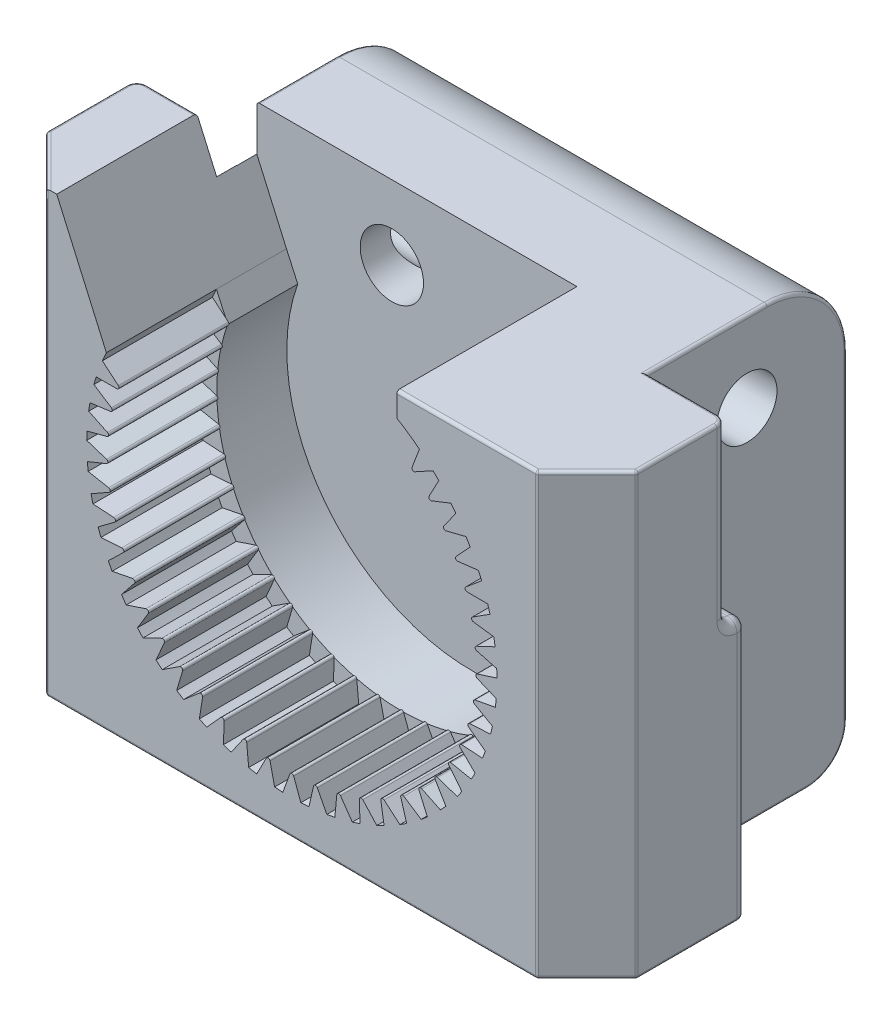
from build123d import *

# Parameters (mm, degrees)
SKETCH_1_W               = 59
SKETCH_1_H               = 44
EXTRUDE_1_DEPTH          = 34
SKETCH_2_R               = 4
CUT_EXTRUDE_1_DEPTH      = 51.102395152
CUT_EXTRUDE_2_DEPTH      = 63.946405775
CUT_EXTRUDE_3_DEPTH      = 18
CHAMFER_1_SIZE           = 5
CHAMFER_2_SIZE           = 5
FILLET_1_R               = 4
FILLET_2_R               = 8
SKETCH_6_R               = 3
CUT_EXTRUDE_4_DEPTH      = 66.122960621
CUT_EXTRUDE_5_DEPTH      = 2
FILLET_START             = -30
FILLET_3_DEPTH           = 8.5
FILLET_START_2           = 21.5
FILLET_3_2_DEPTH         = 8.5
FILLET_START_3           = -29.5
FILLET_3_3_DEPTH         = 8
FILLET_3_4_DEPTH         = 8
FILLET_4_R               = 1
FILLET_5_R               = 0.3
FILLET_6_R               = 0.3
EXTRUDE_START            = 7
EXTRUDE_2_DEPTH          = 7
EXTRUDE_3_DEPTH          = 11
PATTERN_CIRCULAR_1_COUNT = 16
PATTERN_CIRCULAR_1_ANGLE = 110
PATTERN_CIRCULAR_2_COUNT = 20
PATTERN_CIRCULAR_2_ANGLE = 139
SKETCH_11_R              = 3.162938161
CUT_EXTRUDE_6_DEPTH      = 41.966449688


with BuildPart() as part:
    # Эскиз1 → Бобышка-Вытянуть1 (new body)
    with BuildSketch(Plane.XY):
        Rectangle(SKETCH_1_W, SKETCH_1_H)
    extrude(amount=EXTRUDE_1_DEPTH)

    # Эскиз2 → Вырез-Вытянуть1 (cut, through all)
    with BuildSketch(Plane.XY.offset(34)):
        with Locations((0, 2)):
            Circle(SKETCH_2_R)
    extrude(amount=-CUT_EXTRUDE_1_DEPTH, mode=Mode.SUBTRACT)

    # Эскиз3 → Вырез-Вытянуть2 (cut, through all)
    with BuildSketch(Plane(origin=(0, 22, 0), x_dir=(1, 0, 0), z_dir=(0, 1, 0))):
        Polygon((-21.5, 5.182820552), (-21.5, -18), (-29.840908982, -18), (-29.840908982, 8.49465206), (29.840908982, 8.49465206), (29.840908982, -18), (21.5, -18), (21.5, 5.182820552), align=None)
    extrude(amount=-CUT_EXTRUDE_2_DEPTH, mode=Mode.SUBTRACT)

    # Эскиз4 → Вырез-Вытянуть3 (cut)
    with BuildSketch(Plane.XY.offset(34)):
        with BuildLine():
            Line((-23.5, 22), (-18.535280006, 10.757476525))
            ThreePointArc((-18.535280006, 10.757476525), (5.976548945, -17.609458501), (10.5, 19.606816862))
            Line((10.5, 19.606816862), (10.5, 22))
            Line((10.5, 22), (-23.5, 22))
        make_face()
    extrude(amount=-CUT_EXTRUDE_3_DEPTH, mode=Mode.SUBTRACT)

    # Фаска1
    chamfer_1_edges = [part.edges().sort_by_distance(p)[0] for p in [
        (-29.5, 0, 34),
    ]]
    chamfer(chamfer_1_edges, length=CHAMFER_1_SIZE)

    # Фаска2
    chamfer_2_edges = [part.edges().sort_by_distance(p)[0] for p in [
        (29.5, 0, 34),
    ]]
    chamfer(chamfer_2_edges, length=CHAMFER_2_SIZE)

    # Скругление1
    fillet_1_edges = [part.edges().sort_by_distance(p)[0] for p in [
        (0, -22, 0),
    ]]
    fillet(fillet_1_edges, radius=FILLET_1_R)

    # Скругление2
    fillet_2_edges = [part.edges().sort_by_distance(p)[0] for p in [
        (0, 22, 0),
    ]]
    fillet(fillet_2_edges, radius=FILLET_2_R)

    # Эскиз6 → Вырез-Вытянуть4 (cut, through all)
    with BuildSketch(Plane.ZY.offset(21.5)):
        with Locations((10, 14)):
            Circle(SKETCH_6_R)
    extrude(amount=-CUT_EXTRUDE_4_DEPTH, mode=Mode.SUBTRACT)

    # Эскиз7 → Вырез-Вытянуть5 (cut)
    with BuildSketch(Plane(origin=(0, 0, 18), x_dir=(-1, 0, 0), z_dir=(0, 0, -1))):
        Polygon((-29.5, 4), (-21.5, 4), (-21.5, 24.855557452), (21.514282903, 24.855557452), (21.5, 4), (29.5, 4), (29.5, 28.131804125), (-29.5, 28.131804125), align=None)
    extrude(amount=-CUT_EXTRUDE_5_DEPTH, mode=Mode.SUBTRACT)

    # Скругление3: read off the stored shape, not the designer's step
    # Скругление3 outline → Скругление3 (cut)
    with BuildSketch(Plane.YZ.offset(FILLET_START)):
        with BuildLine():
            Line((4, 18), (4, 19))
            ThreePointArc((4, 19), (3.707106781, 18.292893219), (3, 18))
            Line((3, 18), (4, 18))
        make_face()
    extrude(amount=FILLET_3_DEPTH, mode=Mode.SUBTRACT)

    # Fillet 3 2 outline → Fillet 3 2 (cut)
    with BuildSketch(Plane.YZ.offset(FILLET_START_2)):
        with BuildLine():
            Line((4, 18), (4, 19))
            ThreePointArc((4, 19), (3.707106781, 18.292893219), (3, 18))
            Line((3, 18), (4, 18))
        make_face()
    extrude(amount=FILLET_3_2_DEPTH, mode=Mode.SUBTRACT)

    # Fillet 3 3 outline → Fillet 3 3 (add)
    with BuildSketch(Plane.YZ.offset(FILLET_START_3)):
        with BuildLine():
            Line((4, 20), (4, 19))
            ThreePointArc((4, 19), (4.292893219, 19.707106781), (5, 20))
            Line((5, 20), (4, 20))
        make_face()
    extrude(amount=FILLET_3_3_DEPTH)

    # Fillet 3 4 outline → Fillet 3 4 (add)
    with BuildSketch(Plane.YZ.offset(FILLET_START_2)):
        with BuildLine():
            Line((4, 20), (4, 19))
            ThreePointArc((4, 19), (4.292893219, 19.707106781), (5, 20))
            Line((5, 20), (4, 20))
        make_face()
    extrude(amount=FILLET_3_4_DEPTH)

    # Скругление4
    fillet_4_edges = [part.edges().sort_by_distance(p)[0] for p in [
        (29.5, 13.5, 20),
        (-29.5, 13.5, 20),
        (-29.5, -9.5, 18),
        (-29.5, 3.707106781, 18.292893219),
        (29.5, 3.707106781, 18.292893219),
        (-29.5, 4.292893219, 19.707106781),
        (29.5, 4.292893219, 19.707106781),
        (29.5, -9.5, 18),
    ]]
    fillet(fillet_4_edges, radius=FILLET_4_R)

    # Скругление5
    fillet_5_edges = [part.edges().sort_by_distance(p)[0] for p in [
        (21.5, -22, 11),
        (21.5, -2, 0),
        (21.5, -20.828427125, 1.171572875),
        (-21.5, -20.828427125, 1.171572875),
        (21.5, 22, 14),
        (-21.5, -2, 0),
        (-21.5, 19.656854249, 2.343145751),
        (21.5, 19.656854249, 2.343145751),
        (-21.5, -22, 11),
        (-21.5, 22, 12),
    ]]
    fillet(fillet_5_edges, radius=FILLET_5_R)

    # Скругление6
    fillet_6_edges = [part.edges().sort_by_distance(p)[0] for p in [
        (-26, 22, 20),
        (-29.207106781, 22, 20.292893219),
        (24.85, 22, 20),
        (29.207106781, 22, 20.292893219),
        (-24.85, -22, 18),
        (-29.207106781, -22, 18.292893219),
        (24.85, -22, 18),
        (29.207106781, -22, 18.292893219),
        (-29.5, 0, 29),
        (-29.5, 22, 25),
        (-27, 22, 31.5),
        (-24.5, 0, 34),
        (29.5, 22, 25),
        (27, 22, 31.5),
        (17.5, 22, 34),
        (29.5, 0, 29),
        (24.5, 0, 34),
        (-29.5, -22, 24),
        (-27, -22, 31.5),
        (29.5, -22, 24),
        (27, -22, 31.5),
        (0, -22, 34),
    ]]
    fillet(fillet_6_edges, radius=FILLET_6_R)

    # Эскиз8 → Бобышка-Вытянуть2 (add)
    with BuildSketch(Plane.XY.offset(16).offset(EXTRUDE_START)):
        with BuildLine():
            Line((-18.535280006, 10.757476525), (-17.407140213, 8.264301206))
            ThreePointArc((-17.407140213, 8.264301206), (5.659506801, -15.613062845), (10.5, 17.231546212))
            Line((10.5, 17.231546212), (10.5, 19.606816862))
            ThreePointArc((10.5, 19.606816862), (5.976548945, -17.609458501), (-18.535280006, 10.757476525))
        make_face()
    extrude(amount=-EXTRUDE_2_DEPTH)

    # Эскиз10 → Бобышка-Вытянуть3 (add)
    with BuildSketch(Plane.XY.offset(23)):
        with BuildLine():
            Line((-0.187775263, -16.530367751), (-1.1, -19.018253397))
            Line((-1.1, -19.018253397), (1.1, -19.018253397))
            Line((1.1, -19.018253397), (0.187775263, -16.530367751))
            ThreePointArc((0.187775263, -16.530367751), (0, -16.399218681), (-0.187775263, -16.530367751))
        make_face()
    extrude_3 = extrude(amount=EXTRUDE_3_DEPTH)

    # Круговой массив1: Бобышка-Вытянуть3 ×16 about axis
    pattern_circular_1_axis = Axis((0, 2, 0), (0, 0, -1))
    for i in range(1, PATTERN_CIRCULAR_1_COUNT):
        add(extrude_3.rotate(pattern_circular_1_axis, i * PATTERN_CIRCULAR_1_ANGLE / (PATTERN_CIRCULAR_1_COUNT - 1)))

    # Круговой массив2: Бобышка-Вытянуть3 ×20 about axis
    pattern_circular_2_axis = Axis((0, 2, 0), (0, 0, 1))
    for i in range(1, PATTERN_CIRCULAR_2_COUNT):
        add(extrude_3.rotate(pattern_circular_2_axis, i * PATTERN_CIRCULAR_2_ANGLE / (PATTERN_CIRCULAR_2_COUNT - 1)))

    # Зеркальное отражение1: read off the stored shape, not the designer's step
    # Зеркальное отражение1: part across plane


with BuildPart() as part_1:
    add(part.part)
    add(part.part.mirror(Plane(origin=(0, -22, 0), x_dir=(0, 0, 1), z_dir=(0, -1, 0))))

    # Split Bodies 1
    split(bisect_by=Plane(origin=(0, -22, 0), x_dir=(-1, 0, 0), z_dir=(0, -1, 0)), keep=Keep.BOTTOM)

    # Эскиз11 → Вырез-Вытянуть6 (cut, through all)
    with BuildSketch(Plane.XY.offset(16)):
        with Locations((-8.000372996, 14.605332096)):
            Circle(SKETCH_11_R)
    extrude(amount=-CUT_EXTRUDE_6_DEPTH, mode=Mode.SUBTRACT)


solid = part_1.part
